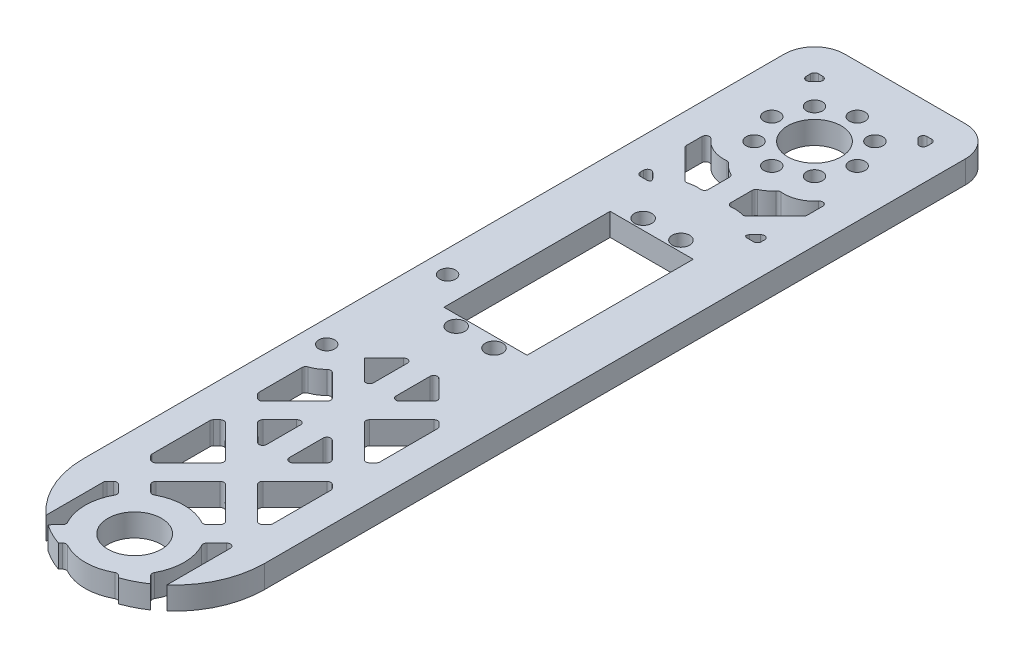
from build123d import *

# Parameters (mm, degrees)
BOSS_EXTRUDE1_OUTLINE_W   = 48
BOSS_EXTRUDE1_OUTLINE_H   = 238.294372516
BOSS_EXTRUDE1_OUTLINE_R   = 2.1
BOSS_EXTRUDE1_OUTLINE_R_2 = 7.1
BOSS_EXTRUDE1_OUTLINE_R_3 = 2.3
BOSS_EXTRUDE1_DEPTH       = 6
FILLET2_R                 = 8
FILLET3_R                 = 1
SKETCH2_W                 = 22
SKETCH2_H                 = 44
CUT_EXTRUDE1_DEPTH        = 10
CUT_EXTRUDE2_DEPTH        = 10


# Read off the part's stored shape, not the designer's step: Boss-Extrude1
with BuildPart() as part:
    # Boss-Extrude1 outline → Boss-Extrude1 (new body)
    with BuildSketch(Plane(origin=(0, 0, 0), x_dir=(1, 0, 0), z_dir=(0, 1, 0))):
        Rectangle(BOSS_EXTRUDE1_OUTLINE_W, BOSS_EXTRUDE1_OUTLINE_H)
        with BuildLine():
            Line((-16, -76.811183182), (-14.142135624, -74.953318806))
            Line((-14.142135624, -74.953318806), (-11.138248867, -77.957205562))
            ThreePointArc((-11.138248867, -77.957205562), (-13.1, -84.852813742), (-11.138248867, -91.748421922))
            Line((-11.138248867, -91.748421922), (-16, -96.852813742))
            Line((-16, -96.852813742), (-16, -76.811183182))
        make_face(mode=Mode.SUBTRACT)
        with Locations((-18, -16)):
            Circle(BOSS_EXTRUDE1_OUTLINE_R, mode=Mode.SUBTRACT)
        Polygon((-16, -48.526911935), (-14.142135624, -46.669047558), (-4.242640687, -56.568542495), (-14.142135624, -66.468037432), (-16, -64.610173055), align=None, mode=Mode.SUBTRACT)
        Polygon((-9.899494937, -42.426406871), (-3, -35.526911935), (-3, -49.325901808), align=None, mode=Mode.SUBTRACT)
        with BuildLine():
            ThreePointArc((-16, -23.849203781), (-13.54798687, -22.766799767), (-11.58344691, -20.943465024))
            Line((-11.58344691, -20.943465024), (-4.242640687, -28.284271247))
            Line((-4.242640687, -28.284271247), (-14.142135624, -38.183766184))
            Line((-14.142135624, -38.183766184), (-16, -36.325901808))
            Line((-16, -36.325901808), (-16, -23.849203781))
        make_face(mode=Mode.SUBTRACT)
        Polygon((-3, -7.242640687), (-3, -21.04163056), (-9.899494937, -14.142135624), align=None, mode=Mode.SUBTRACT)
        with BuildLine():
            Line((16, -105.09545443), (16, -111.147186258))
            Line((16, -111.147186258), (-16, -111.147186258))
            Line((-16, -111.147186258), (-16, -105.09545443))
            Line((-16, -105.09545443), (-6.89560818, -95.99106261))
            ThreePointArc((-6.89560818, -95.99106261), (0, -97.952813742), (6.89560818, -95.99106261))
            Line((6.89560818, -95.99106261), (16, -105.09545443))
        make_face(mode=Mode.SUBTRACT)
        with Locations((0, -84.852813742)):
            Circle(BOSS_EXTRUDE1_OUTLINE_R_2, mode=Mode.SUBTRACT)
        with BuildLine():
            Line((-9.899494937, -70.710678119), (0, -60.811183182))
            Line((0, -60.811183182), (9.899494937, -70.710678119))
            Line((9.899494937, -70.710678119), (6.89560818, -73.714564875))
            ThreePointArc((6.89560818, -73.714564875), (0, -71.752813742), (-6.89560818, -73.714564875))
            Line((-6.89560818, -73.714564875), (-9.899494937, -70.710678119))
        make_face(mode=Mode.SUBTRACT)
        with BuildLine():
            ThreePointArc((11.138248867, -91.748421922), (13.1, -84.852813742), (11.138248867, -77.957205562))
            Line((11.138248867, -77.957205562), (16, -73.09545443))
            Line((16, -73.09545443), (16, -96.610173055))
            Line((16, -96.610173055), (11.138248867, -91.748421922))
        make_face(mode=Mode.SUBTRACT)
        Polygon((16, -64.610173055), (14.142135624, -66.468037432), (4.242640687, -56.568542495), (14.142135624, -46.669047558), (16, -48.526911935), align=None, mode=Mode.SUBTRACT)
        Polygon((3, -49.325901808), (3, -35.526911935), (9.899494937, -42.426406871), align=None, mode=Mode.SUBTRACT)
        Polygon((16, -20.242640687), (16, -36.325901808), (14.142135624, -38.183766184), (4.242640687, -28.284271247), (14.142135624, -18.384776311), align=None, mode=Mode.SUBTRACT)
        Polygon((3, -21.04163056), (3, -7.242640687), (9.899494937, -14.142135624), align=None, mode=Mode.SUBTRACT)
        with Locations((-18, 16)):
            Circle(BOSS_EXTRUDE1_OUTLINE_R, mode=Mode.SUBTRACT)
        with Locations((-5, 5.29163056)):
            Circle(BOSS_EXTRUDE1_OUTLINE_R_3, mode=Mode.SUBTRACT)
        with Locations((-5, 54.79163056)):
            Circle(BOSS_EXTRUDE1_OUTLINE_R_3, mode=Mode.SUBTRACT)
        with BuildLine():
            Line((-16, 64.04163056), (-16, 68.325901808))
            Line((-16, 68.325901808), (-12.340197169, 64.666098977))
            ThreePointArc((-12.340197169, 64.666098977), (-12.495227028, 64.35695969), (-12.637244267, 64.04163056))
            Line((-12.637244267, 64.04163056), (-16, 64.04163056))
        make_face(mode=Mode.SUBTRACT)
        with BuildLine():
            Line((-16, 104.416044012), (-16, 111.147186258))
            Line((-16, 111.147186258), (-9.268857754, 111.147186258))
            ThreePointArc((-9.268857754, 111.147186258), (-13.727564927, 108.874751186), (-16, 104.416044012))
        make_face(mode=Mode.SUBTRACT)
        with BuildLine():
            ThreePointArc((-3, 68.84706351), (-5.415514703, 69.081223284), (-7.795506233, 68.606689415))
            Line((-7.795506233, 68.606689415), (-16, 76.811183182))
            Line((-16, 76.811183182), (-16, 85.878328504))
            ThreePointArc((-16, 85.878328504), (-12.713847902, 80.560105117), (-6.619770226, 79.165647197))
            ThreePointArc((-6.619770226, 79.165647197), (-5.017406312, 77.474575818), (-3, 76.309516036))
            Line((-3, 76.309516036), (-3, 68.84706351))
        make_face(mode=Mode.SUBTRACT)
        with Locations((-8, 87.147186258)):
            Circle(BOSS_EXTRUDE1_OUTLINE_R, mode=Mode.SUBTRACT)
        with Locations((-11.313708499, 95.147186258)):
            Circle(BOSS_EXTRUDE1_OUTLINE_R, mode=Mode.SUBTRACT)
        with Locations((-8, 103.147186258)):
            Circle(BOSS_EXTRUDE1_OUTLINE_R, mode=Mode.SUBTRACT)
        with Locations((5, 5.29163056)):
            Circle(BOSS_EXTRUDE1_OUTLINE_R_3, mode=Mode.SUBTRACT)
        with Locations((5, 54.79163056)):
            Circle(BOSS_EXTRUDE1_OUTLINE_R_3, mode=Mode.SUBTRACT)
        with Locations((0, 83.833477759)):
            Circle(BOSS_EXTRUDE1_OUTLINE_R, mode=Mode.SUBTRACT)
        with Locations((8, 87.147186258)):
            Circle(BOSS_EXTRUDE1_OUTLINE_R, mode=Mode.SUBTRACT)
        with BuildLine():
            ThreePointArc((3, 76.309516036), (5.017406312, 77.474575818), (6.619770226, 79.165647197))
            ThreePointArc((6.619770226, 79.165647197), (12.713847902, 80.560105117), (16, 85.878328504))
            Line((16, 85.878328504), (16, 76.811183182))
            Line((16, 76.811183182), (7.795506233, 68.606689415))
            ThreePointArc((7.795506233, 68.606689415), (5.415514703, 69.081223284), (3, 68.84706351))
            Line((3, 68.84706351), (3, 76.309516036))
        make_face(mode=Mode.SUBTRACT)
        with Locations((0, 95.147186258)):
            Circle(BOSS_EXTRUDE1_OUTLINE_R_2, mode=Mode.SUBTRACT)
        with Locations((0, 106.460894757)):
            Circle(BOSS_EXTRUDE1_OUTLINE_R, mode=Mode.SUBTRACT)
        with Locations((8, 103.147186258)):
            Circle(BOSS_EXTRUDE1_OUTLINE_R, mode=Mode.SUBTRACT)
        with Locations((11.313708499, 95.147186258)):
            Circle(BOSS_EXTRUDE1_OUTLINE_R, mode=Mode.SUBTRACT)
        with BuildLine():
            ThreePointArc((12.637244267, 64.04163056), (12.495227028, 64.35695969), (12.340197169, 64.666098977))
            Line((12.340197169, 64.666098977), (16, 68.325901808))
            Line((16, 68.325901808), (16, 64.04163056))
            Line((16, 64.04163056), (12.637244267, 64.04163056))
        make_face(mode=Mode.SUBTRACT)
        with BuildLine():
            Line((9.268857754, 111.147186258), (16, 111.147186258))
            Line((16, 111.147186258), (16, 104.416044012))
            ThreePointArc((16, 104.416044012), (13.727564927, 108.874751186), (9.268857754, 111.147186258))
        make_face(mode=Mode.SUBTRACT)
    extrude(amount=BOSS_EXTRUDE1_DEPTH)

    # Fillet2
    fillet2_edges = [part.edges().sort_by_distance(p)[0] for p in [
        (24, 3, 119.147186258),
        (-24, 3, 119.147186258),
        (-24, 3, -119.147186258),
        (24, 3, -119.147186258),
    ]]
    fillet(fillet2_edges, radius=FILLET2_R)

    # Fillet3
    # the kernel refuses this fillet: 1 mm, written as the material it adds along each edge
    with BuildSketch(Plane(origin=(16, 0, -68.325901808), x_dir=(-0.7071067811865482, 0, 0.7071067811865468), z_dir=(0, 1, 0)), Plane(origin=(-3, 0, 21.04163056), x_dir=(0, 0, -1), z_dir=(0, 1, 0)), Plane(origin=(3, 0, 7.242640687), x_dir=(0, 0, 1), z_dir=(0, 1, 0)), Plane(origin=(-3, 0, 49.325901808), x_dir=(0, 0, -1), z_dir=(0, 1, 0)), Plane(origin=(-3, 0, 35.526911935), x_dir=(-0.7071067812377916, 0, 0.7071067811353036), z_dir=(0, 1, 0)), Plane(origin=(3, 0, 35.526911935), x_dir=(0, 0, 1), z_dir=(0, 1, 0)), Plane(origin=(16, 0, 96.610173055), x_dir=(0, 0, -1), z_dir=(0, 1, 0)), Plane(origin=(16, 0, 73.09545443), x_dir=(-0.7071067812592687, 0, 0.7071067811138264), z_dir=(0, 1, 0)), Plane(origin=(-16, 0, -68.325901808), x_dir=(0, 0, 1), z_dir=(0, 1, 0))) as fillet3_piece_1:
        with BuildLine():
            CenterArc((FILLET3_R * 2.41421356237, FILLET3_R), FILLET3_R, 135, 135)
            Line((FILLET3_R * 1.70710678119, FILLET3_R * 1.70710678119), (0, 0))
            Line((0, 0), (FILLET3_R * 2.41421356237, 0))
        make_face()
    extrude(amount=6)
    with BuildSketch(Plane(origin=(12.340197169, 0, -64.666098977), x_dir=(0.4308847102163097, 0, 0.9024069849584537), z_dir=(0, 1, 0))) as fillet3_piece_2:
        with BuildLine():
            CenterArc((0.707326263, 0.999192096), FILLET3_R, 199.476280817, 68.220439009)
            Line((-0.235453336, 0.665775498), (0, 0))
            ThreePointArc((0, 0), (0.333568633, 0.006705603), (0.667137267, 0))
        make_face()
    extrude(amount=6)
    with BuildSketch(Plane(origin=(12.637244267, 0, -64.04163056), x_dir=(-0.4245549363958838, 0, -0.905402179134713), z_dir=(0, 1, 0))) as fillet3_piece_3:
        with BuildLine():
            CenterArc((0.635874596, -0.999347126), FILLET3_R, 92.070503693, 62.807000715)
            Line((-0.269527583, -0.574792189), (0, 0))
            ThreePointArc((0, 0), (0.299872677, -0.005418855), (0.599745354, 0))
        make_face()
    extrude(amount=6)
    with BuildSketch(Plane(origin=(16, 0, -64.04163056), x_dir=(0, 0, -1), z_dir=(0, 1, 0)), Plane(origin=(-14.142135624, 0, 38.183766184), x_dir=(0.7071067811865476, 0, -0.7071067811865476), z_dir=(0, 1, 0)), Plane(origin=(-4.242640687, 0, 28.284271247), x_dir=(-0.7071067811865471, 0, -0.707106781186548), z_dir=(0, 1, 0)), Plane(origin=(9.899494937, 0, 14.142135624), x_dir=(-0.7071067811865477, 0, -0.7071067811865477), z_dir=(0, 1, 0)), Plane(origin=(14.142135624, 0, 38.183766184), x_dir=(0.7071067811865485, 0, -0.7071067811865467), z_dir=(0, 1, 0)), Plane(origin=(14.142135624, 0, 18.384776311), x_dir=(-0.7071067812222603, 0, 0.7071067811508348), z_dir=(0, 1, 0)), Plane(origin=(4.242640687, 0, 28.284271247), x_dir=(0.707106781186547, 0, 0.7071067811865479), z_dir=(0, 1, 0)), Plane(origin=(9.899494937, 0, 42.426406871), x_dir=(-0.7071067812377902, 0, -0.7071067811353051), z_dir=(0, 1, 0)), Plane(origin=(-4.242640687, 0, 56.568542495), x_dir=(-0.7071067811865462, 0, -0.7071067811865489), z_dir=(0, 1, 0)), Plane(origin=(-14.142135624, 0, 46.669047558), x_dir=(-0.7071067809962447, 0, 0.7071067813768505), z_dir=(0, 1, 0)), Plane(origin=(-14.142135624, 0, 66.468037432), x_dir=(0.7071067811865449, 0, -0.7071067811865502), z_dir=(0, 1, 0)), Plane(origin=(4.242640687, 0, 56.568542495), x_dir=(0.7071067811865462, 0, 0.7071067811865489), z_dir=(0, 1, 0)), Plane(origin=(14.142135624, 0, 66.468037432), x_dir=(0.70710678099625, 0, -0.7071067813768451), z_dir=(0, 1, 0)), Plane(origin=(14.142135624, 0, 46.669047558), x_dir=(-0.7071067811865476, 0, 0.7071067811865476), z_dir=(0, 1, 0)), Plane(origin=(9.899494937, 0, 70.710678119), x_dir=(-0.7071067811865502, 0, -0.7071067811865449), z_dir=(0, 1, 0)), Plane(origin=(0, 0, 60.811183182), x_dir=(-0.7071067811865471, 0, 0.707106781186548), z_dir=(0, 1, 0)), Plane(origin=(-9.899494937, 0, 70.710678119), x_dir=(0.7071067813042454, 0, 0.7071067810688497), z_dir=(0, 1, 0)), Plane(origin=(-14.142135624, 0, 74.953318806), x_dir=(-0.7071067811865493, 0, 0.7071067811865458), z_dir=(0, 1, 0)), Plane(origin=(-16, 0, 111.147186258), x_dir=(1, 0, 0), z_dir=(0, 1, 0)), Plane(origin=(16, 0, 111.147186258), x_dir=(0, 0, -1), z_dir=(0, 1, 0)), Plane(origin=(-16, 0, -111.147186258), x_dir=(0, 0, 1), z_dir=(0, 1, 0)), Plane(origin=(16, 0, -111.147186258), x_dir=(-1, 0, 0), z_dir=(0, 1, 0))) as fillet3_piece_4:
        with BuildLine():
            CenterArc((FILLET3_R, FILLET3_R), FILLET3_R, 180, 90)
            Line((0, FILLET3_R), (0, 0))
            Line((0, 0), (FILLET3_R, 0))
        make_face()
    extrude(amount=6)
    with BuildSketch(Plane(origin=(6.619770226, 0, -79.165647197), x_dir=(-0.6037581052648008, 0, 0.797167579826888), z_dir=(0, 1, 0))) as fillet3_piece_5:
        with BuildLine():
            CenterArc((0.585430102, 0.999420586), FILLET3_R, 211.229590043, 56.819877757)
            ThreePointArc((-0.269666513, 0.480951898), (-0.130739574, 0.242771249), (0, 0))
            ThreePointArc((0, 0), (0.275696734, 0.004693254), (0.551393468, 0))
        make_face()
    extrude(amount=6)
    with BuildSketch(Plane(origin=(3, 0, -76.309516036), x_dir=(0.9142033912434429, 0, -0.40525567169256055), z_dir=(0, 1, 0))) as fillet3_piece_6:
        with BuildLine():
            CenterArc((0.650877693, -0.999283745), FILLET3_R, 92.168689009, 63.924161156)
            Line((-0.263325698, -0.594028074), (0, 0))
            ThreePointArc((0, 0), (0.306517984, -0.005801663), (0.613035967, 0))
        make_face()
    extrude(amount=6)
    with BuildSketch(Plane(origin=(3, 0, -68.84706351), x_dir=(0.9846311528211374, 0, -0.17464676605685553), z_dir=(0, 1, 0))) as fillet3_piece_7:
        with BuildLine():
            CenterArc((1.192573853, 0.997701658), FILLET3_R, 169.941897263, 96.172770649)
            Line((0.207942701, 1.172348424), (0, 0))
            ThreePointArc((0, 0), (0.562406988, 0.019076236), (1.124813975, 0))
        make_face()
    extrude(amount=6)
    with BuildSketch(Plane(origin=(7.795506233, 0, -68.606689415), x_dir=(0.7071067811865467, 0, -0.7071067811865482), z_dir=(0, 1, 0))) as fillet3_piece_8:
        with BuildLine():
            CenterArc((0.608506021, 1), FILLET3_R, 209.286598582, 60.713401418)
            ThreePointArc((-0.263677694, 0.510821538), (-0.127415064, 0.257694253), (0, 0))
            Line((0, 0), (0.608506021, 0))
        make_face()
    extrude(amount=6)
    with BuildSketch(Plane(origin=(16, 0, -76.811183182), x_dir=(0, 0, -1), z_dir=(0, 1, 0)), Plane(origin=(-16, 0, 36.325901808), x_dir=(0.7071067811865432, 0, 0.7071067811865518), z_dir=(0, 1, 0)), Plane(origin=(16, 0, 36.325901808), x_dir=(0, 0, -1), z_dir=(0, 1, 0)), Plane(origin=(-16, 0, 64.610173055), x_dir=(0.7071067809962474, 0, 0.7071067813768478), z_dir=(0, 1, 0)), Plane(origin=(16, 0, 48.526911935), x_dir=(-0.7071067809962516, 0, -0.7071067813768435), z_dir=(0, 1, 0)), Plane(origin=(-16, 0, 76.811183182), x_dir=(0, 0, 1), z_dir=(0, 1, 0)), Plane(origin=(-16, 0, 105.09545443), x_dir=(0, 0, 1), z_dir=(0, 1, 0)), Plane(origin=(-16, 0, -76.811183182), x_dir=(0.7071067811865432, 0, 0.7071067811865518), z_dir=(0, 1, 0))) as fillet3_piece_9:
        with BuildLine():
            CenterArc((FILLET3_R * 0.414213562373, FILLET3_R), FILLET3_R, 225, 45)
            Line((-FILLET3_R * 0.292893218813, FILLET3_R * 0.292893218813), (0, 0))
            Line((0, 0), (FILLET3_R * 0.414213562373, 0))
        make_face()
    extrude(amount=6)
    with BuildSketch(Plane(origin=(16, 0, -85.878328504), x_dir=(-0.41252887952307427, 0, 0.9109445227671314), z_dir=(0, 1, 0))) as fillet3_piece_10:
        with BuildLine():
            CenterArc((4.553481316, 0.964320574), FILLET3_R, 114.363794366, 140.28486277)
            Line((4.140952436, 1.875265097), (0, 0))
            ThreePointArc((0, 0), (2.144372015, 0.28900335), (4.28874403, 0))
        make_face()
    extrude(amount=6)
    with BuildSketch(Plane(origin=(-11.58344691, 0, 20.943465024), x_dir=(-0.6583571135214472, 0, 0.7527057267456575), z_dir=(0, 1, 0))) as fillet3_piece_11:
        with BuildLine():
            CenterArc((1.068967125, 0.998066867), FILLET3_R, 176.174696969, 90.262116891)
            Line((0.071195022, 1.064781411), (0, 0))
            ThreePointArc((0, 0), (0.503408937, 0.015658379), (1.006817873, 0))
        make_face()
    extrude(amount=6)
    with BuildSketch(Plane(origin=(-16, 0, 23.849203781), x_dir=(0.9574613467239408, 0, -0.2885615524105347), z_dir=(0, 1, 0))) as fillet3_piece_12:
        with BuildLine():
            CenterArc((0.743328227, -0.99906572), FILLET3_R, 92.476909225, 70.751232927)
            Line((-0.21413312, -0.710504167), (0, 0))
            ThreePointArc((0, 0), (0.350055735, -0.007567672), (0.700111469, 0))
        make_face()
    extrude(amount=6)
    with BuildSketch(Plane(origin=(-3, 0, 7.242640687), x_dir=(0, 0, 1), z_dir=(0, 1, 0)), Plane(origin=(3, 0, 21.04163056), x_dir=(0, 0, -1), z_dir=(0, 1, 0)), Plane(origin=(3, 0, 49.325901808), x_dir=(0, 0, -1), z_dir=(0, 1, 0))) as fillet3_piece_13:
        with BuildLine():
            CenterArc((FILLET3_R * 2.41421356237, -FILLET3_R), FILLET3_R, 90, 135)
            Line((FILLET3_R * 1.70710678119, -FILLET3_R * 1.70710678119), (0, 0))
            Line((0, 0), (FILLET3_R * 2.41421356237, 0))
        make_face()
    extrude(amount=6)
    with BuildSketch(Plane(origin=(16, 0, 20.242640687), x_dir=(0, 0, 1), z_dir=(0, 1, 0)), Plane(origin=(-16, 0, 48.526911935), x_dir=(0.7071067809962451, 0, -0.7071067813768499), z_dir=(0, 1, 0)), Plane(origin=(16, 0, 64.610173055), x_dir=(-0.7071067809962409, 0, 0.7071067813768542), z_dir=(0, 1, 0)), Plane(origin=(16, 0, 105.09545443), x_dir=(0, 0, 1), z_dir=(0, 1, 0))) as fillet3_piece_14:
        with BuildLine():
            CenterArc((FILLET3_R * 0.414213562373, -FILLET3_R), FILLET3_R, 90, 45)
            Line((-FILLET3_R * 0.292893218813, -FILLET3_R * 0.292893218813), (0, 0))
            Line((0, 0), (FILLET3_R * 0.414213562373, 0))
        make_face()
    extrude(amount=6)
    with BuildSketch(Plane(origin=(-9.899494937, 0, 42.426406871), x_dir=(0.7071067812377928, 0, -0.7071067811353023), z_dir=(0, 1, 0)), Plane(origin=(-16, 0, -64.04163056), x_dir=(0, 0, -1), z_dir=(0, 1, 0))) as fillet3_piece_15:
        with BuildLine():
            CenterArc((FILLET3_R, -FILLET3_R), FILLET3_R, 90, 90.000000004)
            Line((0, -FILLET3_R), (0, 0))
            Line((0, 0), (FILLET3_R, 0))
        make_face()
    extrude(amount=6)
    with BuildSketch(Plane(origin=(-6.89560818, 0, 73.714564875), x_dir=(-0.7071067813042446, 0, -0.7071067810688503), z_dir=(0, 1, 0)), Plane(origin=(11.138248867, 0, 77.957205562), x_dir=(0.7071067812592654, 0, -0.7071067811138299), z_dir=(0, 1, 0))) as fillet3_piece_16:
        with BuildLine():
            CenterArc((0.768862224, -1), FILLET3_R, 90, 73.519563392)
            ThreePointArc((-0.190054431, -0.716312057), (-0.08996078, -0.359500273), (0, 0))
            Line((0, 0), (0.768862224, 0))
        make_face()
    extrude(amount=6)
    with BuildSketch(Plane(origin=(6.89560818, 0, 73.714564875), x_dir=(0.7071067813042459, 0, -0.707106781068849), z_dir=(0, 1, 0)), Plane(origin=(-11.138248867, 0, 77.957205562), x_dir=(-0.7071067813042412, 0, -0.7071067810688537), z_dir=(0, 1, 0)), Plane(origin=(11.138248867, 0, 91.748421922), x_dir=(0.7071067811865521, 0, 0.7071067811865429), z_dir=(0, 1, 0))) as fillet3_piece_17:
        with BuildLine():
            CenterArc((0.768862224, 1), FILLET3_R, 196.480436608, 73.519563392)
            ThreePointArc((-0.190054431, 0.716312057), (-0.08996078, 0.359500273), (0, 0))
            Line((0, 0), (0.768862224, 0))
        make_face()
    extrude(amount=6)
    with BuildSketch(Plane(origin=(-16, 0, 96.852813742), x_dir=(0.6896868304755513, 0, -0.7241077791797214), z_dir=(0, 1, 0))) as fillet3_piece_18:
        with BuildLine():
            CenterArc((FILLET3_R * 2.49984152661, FILLET3_R), FILLET3_R, 133.605323898, 136.394676102)
            Line((FILLET3_R * 1.81015469614, FILLET3_R * 1.72410777918), (0, 0))
            Line((0, 0), (FILLET3_R * 2.49984152661, 0))
        make_face()
    extrude(amount=6)
    with BuildSketch(Plane(origin=(-11.138248867, 0, 91.748421922), x_dir=(-0.6896868304755495, 0, 0.7241077791797231), z_dir=(0, 1, 0))) as fillet3_piece_19:
        with BuildLine():
            CenterArc((0.750221017, -1), FILLET3_R, 90, 72.203505135)
            ThreePointArc((-0.201927076, -0.694362943), (-0.096171466, -0.34857505), (0, 0))
            Line((0, 0), (0.750221017, 0))
        make_face()
    extrude(amount=6)
    with BuildSketch(Plane(origin=(6.89560818, 0, 95.99106261), x_dir=(-0.8647971046803797, 0, 0.5021214671137179), z_dir=(0, 1, 0))) as fillet3_piece_20:
        with BuildLine():
            CenterArc((0.769382365, 0.999599868), FILLET3_R, 194.859545331, 73.519563388)
            Line((-0.197175027, 0.743149465), (0, 0))
            ThreePointArc((0, 0), (0.370548124, 0.005241732), (0.741096248, 0))
        make_face()
    extrude(amount=6)
    with BuildSketch(Plane(origin=(-6.89560818, 0, 95.99106261), x_dir=(-0.7071067811865447, 0, 0.7071067811865505), z_dir=(0, 1, 0))) as fillet3_piece_21:
        with BuildLine():
            CenterArc((0.768862223, 1), FILLET3_R, 196.480436612, 73.519563388)
            ThreePointArc((-0.190054431, 0.716312057), (-0.08996078, 0.359500273), (0, 0))
            Line((0, 0), (0.768862223, 0))
        make_face()
    extrude(amount=6)
    with BuildSketch(Plane(origin=(-9.268857754, 0, -111.147186258), x_dir=(-1, 0, 0), z_dir=(0, 1, 0)), Plane(origin=(16, 0, -104.416044012), x_dir=(0, 0, -1), z_dir=(0, 1, 0))) as fillet3_piece_22:
        with BuildLine():
            CenterArc((4.54577895, 1), FILLET3_R, 129.715137231, 140.284862769)
            ThreePointArc((3.906807883, 1.769230769), (2.07262617, 0.621349366), (0, 0))
            Line((0, 0), (4.54577895, 0))
        make_face()
    extrude(amount=6)
    with BuildSketch(Plane(origin=(-16, 0, -104.416044012), x_dir=(0, 0, -1), z_dir=(0, 1, 0)), Plane(origin=(9.268857754, 0, -111.147186258), x_dir=(1, 0, 0), z_dir=(0, 1, 0))) as fillet3_piece_23:
        with BuildLine():
            CenterArc((4.54577895, -1), FILLET3_R, 90, 140.284862769)
            ThreePointArc((3.906807883, -1.769230769), (2.07262617, -0.621349366), (0, 0))
            Line((0, 0), (4.54577895, 0))
        make_face()
    extrude(amount=6)
    with BuildSketch(Plane(origin=(-12.340197169, 0, -64.666098977), x_dir=(-0.7071067811865513, 0, -0.7071067811865438), z_dir=(0, 1, 0))) as fillet3_piece_24:
        with BuildLine():
            CenterArc((0.706183607, 1), FILLET3_R, 201.779560991, 68.220439009)
            ThreePointArc((-0.222434638, 0.628963405), (-0.104895413, 0.316717462), (0, 0))
            Line((0, 0), (0.706183607, 0))
        make_face()
    extrude(amount=6)
    with BuildSketch(Plane(origin=(-12.637244267, 0, -64.04163056), x_dir=(0.4245549363958832, 0, -0.9054021791347133), z_dir=(0, 1, 0))) as fillet3_piece_25:
        with BuildLine():
            CenterArc((0.635874596, 0.999347126), FILLET3_R, 205.122495591, 62.807000715)
            Line((-0.269527583, 0.574792189), (0, 0))
            ThreePointArc((0, 0), (0.299872677, 0.005418855), (0.599745354, 0))
        make_face()
    extrude(amount=6)
    with BuildSketch(Plane(origin=(-7.795506233, 0, -68.606689415), x_dir=(0.9526723077305443, 0, -0.30399913500429415), z_dir=(0, 1, 0))) as fillet3_piece_26:
        with BuildLine():
            CenterArc((0.609490627, 0.999400197), FILLET3_R, 207.30204039, 60.713401418)
            Line((-0.279110271, 0.540718997), (0, 0))
            ThreePointArc((0, 0), (0.287430239, 0.004978369), (0.574860478, 0))
        make_face()
    extrude(amount=6)
    with BuildSketch(Plane(origin=(-3, 0, -68.84706351), x_dir=(0, 0, -1), z_dir=(0, 1, 0))) as fillet3_piece_27:
        with BuildLine():
            CenterArc((1.190647301, 1), FILLET3_R, 173.827229351, 96.172770649)
            ThreePointArc((0.196445123, 1.107526881), (0.117005618, 0.550431838), (0, 0))
            Line((0, 0), (1.190647301, 0))
        make_face()
    extrude(amount=6)
    with BuildSketch(Plane(origin=(-3, 0, -76.309516036), x_dir=(-0.9142033912434432, 0, -0.4052556716925597), z_dir=(0, 1, 0))) as fillet3_piece_28:
        with BuildLine():
            CenterArc((0.650877693, 0.999283745), FILLET3_R, 203.907149835, 63.924161156)
            Line((-0.263325698, 0.594028074), (0, 0))
            ThreePointArc((0, 0), (0.306517984, 0.005801663), (0.613035967, 0))
        make_face()
    extrude(amount=6)
    with BuildSketch(Plane(origin=(-6.619770226, 0, -79.165647197), x_dir=(0.603758105264807, 0, 0.7971675798268834), z_dir=(0, 1, 0))) as fillet3_piece_29:
        with BuildLine():
            CenterArc((0.585430102, -0.999420586), FILLET3_R, 91.9505322, 56.819877757)
            ThreePointArc((-0.269666513, -0.480951898), (-0.130739574, -0.242771249), (0, 0))
            ThreePointArc((0, 0), (0.275696734, -0.004693254), (0.551393468, 0))
        make_face()
    extrude(amount=6)
    with BuildSketch(Plane(origin=(-16, 0, -85.878328504), x_dir=(0, 0, 1), z_dir=(0, 1, 0))) as fillet3_piece_30:
        with BuildLine():
            CenterArc((4.54577895, 1), FILLET3_R, 129.71513723, 140.28486277)
            ThreePointArc((3.906807884, 1.769230769), (2.07262617, 0.621349366), (0, 0))
            Line((0, 0), (4.54577895, 0))
        make_face()
    extrude(amount=6)

    # Sketch2 → Cut-Extrude1 (cut)
    with BuildSketch(Plane(origin=(0, 6, 0), x_dir=(1, 0, 0), z_dir=(0, 1, 0))):
        with Locations((0, 30.04163056)):
            Rectangle(SKETCH2_W, SKETCH2_H)
    extrude(amount=-CUT_EXTRUDE1_DEPTH, mode=Mode.SUBTRACT)

    # Sketch3 → Cut-Extrude2 (cut)
    with BuildSketch(Plane(origin=(0, 6, 0), x_dir=(1, 0, 0), z_dir=(0, 1, 0))):
        with BuildLine():
            Line((-24, -74.436010154), (-42.486084246, -124.063746007))
            Line((-42.486084246, -124.063746007), (37.011073389, -122.749743401))
            Line((37.011073389, -122.749743401), (24, -74.436010154))
            ThreePointArc((24, -74.436010154), (0, -98.436010154), (-24, -74.436010154))
        make_face()
    extrude(amount=-CUT_EXTRUDE2_DEPTH, mode=Mode.SUBTRACT)


solid = part.part
